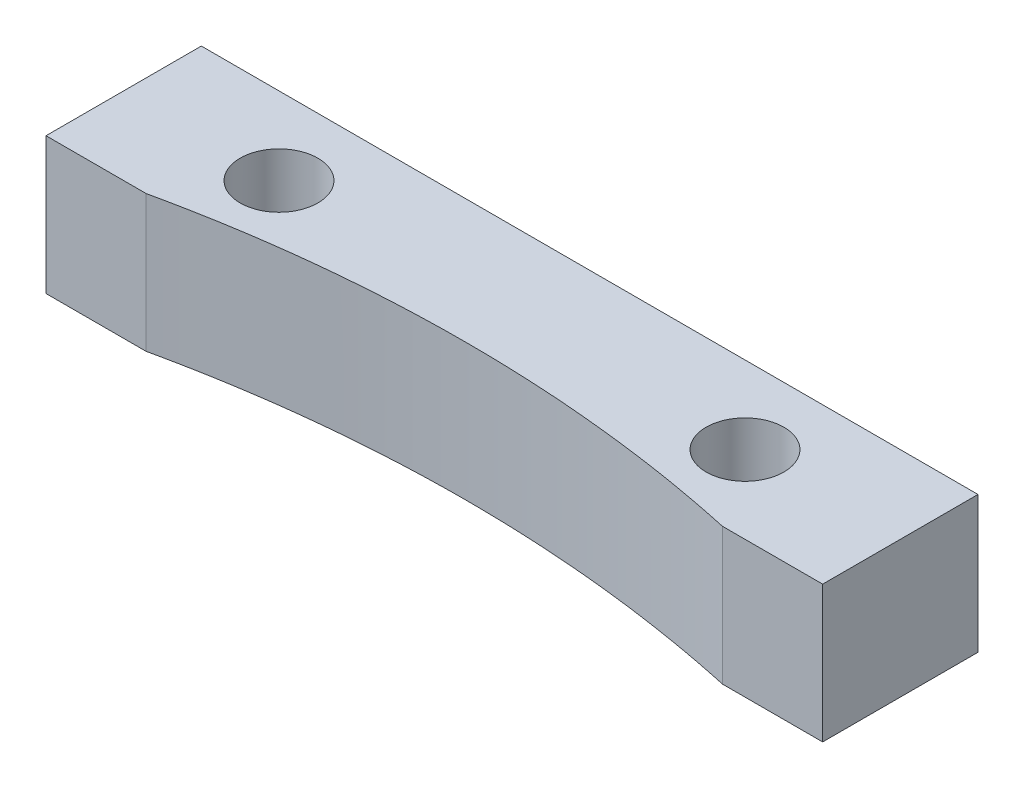
from build123d import *
from OCP.BRepAlgoAPI import BRepAlgoAPI_Cut
from OCP.TopTools import TopTools_ListOfShape

# Parameters (mm, degrees)
BOSS_EXTRUDE1_DEPTH = 4.399999976
SKETCH2_R           = 1.250000156
SKETCH2_R_2         = 1.250000022
CUT_EXTRUDE1_DEPTH  = 21.630317051


with BuildPart() as part:
    # Sketch1 → Boss-Extrude1 (new body)
    with BuildSketch(Plane.XZ):
        Polygon((-4.999999888, -2.499999944), (19.999999553, -2.499999944), (19.999999553, 2.499999944), (16.773618758, 2.499999944), (16.12037234, 2.362702042), (15.465098433, 2.235444495), (14.80794698, 2.118256874), (14.149076305, 2.011166653), (13.488639146, 1.914199442), (12.826791964, 1.827377942), (12.16368936, 1.750722528), (11.499489658, 1.684251358), (10.834347457, 1.627979917), (10.168421082, 1.581921591), (9.501865134, 1.546087209), (8.834838867, 1.520485152), (8.167498745, 1.505121589), (7.499999832, 1.500000013), (6.832501851, 1.505121589), (6.165161263, 1.520485152), (5.498134065, 1.546087209), (4.831579048, 1.581921591), (4.165652208, 1.627979917), (3.500510473, 1.684251358), (2.836310305, 1.750722528), (2.173208632, 1.827377942), (1.511361217, 1.914199442), (0.850924, 2.011166653), (0.192052452, 2.118256874), (-0.465098245, 2.235444495), (-1.120373374, 2.362702042), (-1.773618627, 2.499999944), (-4.999999888, 2.499999944), align=None)
        Polygon((14.745679684, -1.223855186), (14.635442756, -1.195657998), (14.528226107, -1.157553168), (14.424919151, -1.10985653), (14.32637684, -1.052963315), (14.233416878, -0.987344887), (14.146808535, -0.913544965), (14.067269862, -0.832175137), (13.995461166, -0.743909681), (13.9319757, -0.649479916), (13.877340592, -0.549668388), (13.832007535, -0.445302139), (13.796353713, -0.337245961), (13.770672493, -0.226395263), (13.75517901, -0.113668575), (13.749999925, 0), (13.75517901, 0.113668575), (13.770672493, 0.226395263), (13.796353713, 0.337245961), (13.832007535, 0.445302139), (13.877340592, 0.549668388), (13.9319757, 0.649479916), (13.995461166, 0.743909681), (14.067269862, 0.832175137), (14.146808535, 0.913544965), (14.233416878, 0.987344887), (14.32637684, 1.052963315), (14.424919151, 1.10985653), (14.528226107, 1.157553168), (14.635442756, 1.195657998), (14.745679684, 1.223855186), (14.858024195, 1.241911086), (14.971545897, 1.249676105), (15.085303225, 1.24708598), (15.198352747, 1.234162133), (15.309760347, 1.211011549), (15.41859936, 1.177826198), (15.523971058, 1.134880935), (15.625, 1.082531759), (15.720849857, 1.021212316), (15.810728073, 0.951430935), (15.893885866, 0.873765559), (15.969639644, 0.788859907), (16.037357971, 0.697417534), (16.096478328, 0.600196188), (16.146514565, 0.498001347), (16.187049448, 0.391679961), (16.217749566, 0.282112975), (16.238357872, 0.17020831), (16.248704866, 0.056893248), (16.248704866, -0.056893248), (16.238357872, -0.17020831), (16.217749566, -0.282112975), (16.187049448, -0.391679961), (16.146514565, -0.498001347), (16.096478328, -0.600196188), (16.037357971, -0.697417534), (15.969639644, -0.788859907), (15.893885866, -0.873765559), (15.810728073, -0.951430935), (15.720849857, -1.021212316), (15.625, -1.082531759), (15.523971058, -1.134880935), (15.41859936, -1.177826198), (15.309760347, -1.211011549), (15.198352747, -1.234162133), (15.085303225, -1.24708598), (14.971545897, -1.249676105), (14.858024195, -1.241911086), align=None, mode=Mode.SUBTRACT)
        Polygon((0.41859952, -1.177826198), (0.309759722, -1.211011549), (0.198353184, -1.234162133), (0.085303014, -1.24708598), (-0.028453996, -1.249676105), (-0.141975237, -1.241911086), (-0.254320039, -1.223855186), (-0.364557403, -1.195657998), (-0.471773994, -1.157553168), (-0.575081271, -1.10985653), (-0.673623348, -1.052963315), (-0.766583427, -0.987344887), (-0.853191421, -0.913544965), (-0.932729628, -0.832175137), (-1.004538848, -0.743909681), (-1.068024314, -0.649479916), (-1.122659654, -0.549668388), (-1.167992363, -0.445302139), (-1.203646651, -0.337245961), (-1.229327056, -0.226395263), (-1.24482112, -0.113668575), (-1.249999972, 0), (-1.24482112, 0.113668575), (-1.229327056, 0.226395263), (-1.203646651, 0.337245961), (-1.167992363, 0.445302139), (-1.122659654, 0.549668388), (-1.068024314, 0.649479916), (-1.004538848, 0.743909681), (-0.932729628, 0.832175137), (-0.853191421, 0.913544965), (-0.766583427, 0.987344887), (-0.673623348, 1.052963315), (-0.575081271, 1.10985653), (-0.471773994, 1.157553168), (-0.364557403, 1.195657998), (-0.254320039, 1.223855186), (-0.141975237, 1.241911086), (-0.028453996, 1.249676105), (0.085303014, 1.24708598), (0.198353184, 1.234162133), (0.309759722, 1.211011549), (0.41859952, 1.177826198), (0.523970637, 1.134880935), (0.624999986, 1.082531759), (0.720850425, 1.021212316), (0.810727593, 0.951430935), (0.893886841, 0.873765559), (0.969639106, 0.788859907), (1.03735656, 0.697417534), (1.096478198, 0.600196188), (1.146514202, 0.498001347), (1.187049667, 0.391679961), (1.217748853, 0.282112975), (1.238357392, 0.17020831), (1.248704502, 0.056893248), (1.248704502, -0.056893248), (1.238357392, -0.17020831), (1.217748853, -0.282112975), (1.187049667, -0.391679961), (1.146514202, -0.498001347), (1.096478198, -0.600196188), (1.03735656, -0.697417534), (0.969639106, -0.788859907), (0.893886841, -0.873765559), (0.810727593, -0.951430935), (0.720850425, -1.021212316), (0.624999986, -1.082531759), (0.523970637, -1.134880935), align=None, mode=Mode.SUBTRACT)
    extrude(amount=-BOSS_EXTRUDE1_DEPTH)


with BuildPart() as cut_extrude1_tool:
    # Sketch2 → Cut-Extrude1 (new, through all)
    with BuildSketch(Plane.XZ):
        with Locations((15.00000023, 9.9e-08)):
            Circle(SKETCH2_R)
        with Locations((-1.4e-08, 3.9e-08)):
            Circle(SKETCH2_R_2)
        with BuildLine():
            Line((-1.773618627, 2.499999944), (16.773618758, 2.499999944))
            ThreePointArc((16.773618758, 2.499999944), (7.500000065, 1.500000013), (-1.773618627, 2.499999944))
        make_face()
    extrude(amount=-CUT_EXTRUDE1_DEPTH)


with BuildPart() as part_1:
    add(part.part)

    # Cut-Extrude1: cut by cut_extrude1_tool, with a tolerance
    cut_extrude1_stock = TopTools_ListOfShape()
    cut_extrude1_stock.Append(part_1.part.wrapped)
    cut_extrude1_tools = TopTools_ListOfShape()
    cut_extrude1_tools.Append(cut_extrude1_tool.part.wrapped)
    cut_extrude1_cut = BRepAlgoAPI_Cut()
    cut_extrude1_cut.SetArguments(cut_extrude1_stock)
    cut_extrude1_cut.SetTools(cut_extrude1_tools)
    cut_extrude1_cut.SetFuzzyValue(0.00001)
    cut_extrude1_cut.Build()
    add(Compound.cast(cut_extrude1_cut.Shape()).solids(), mode=Mode.REPLACE)


solid = part_1.part
